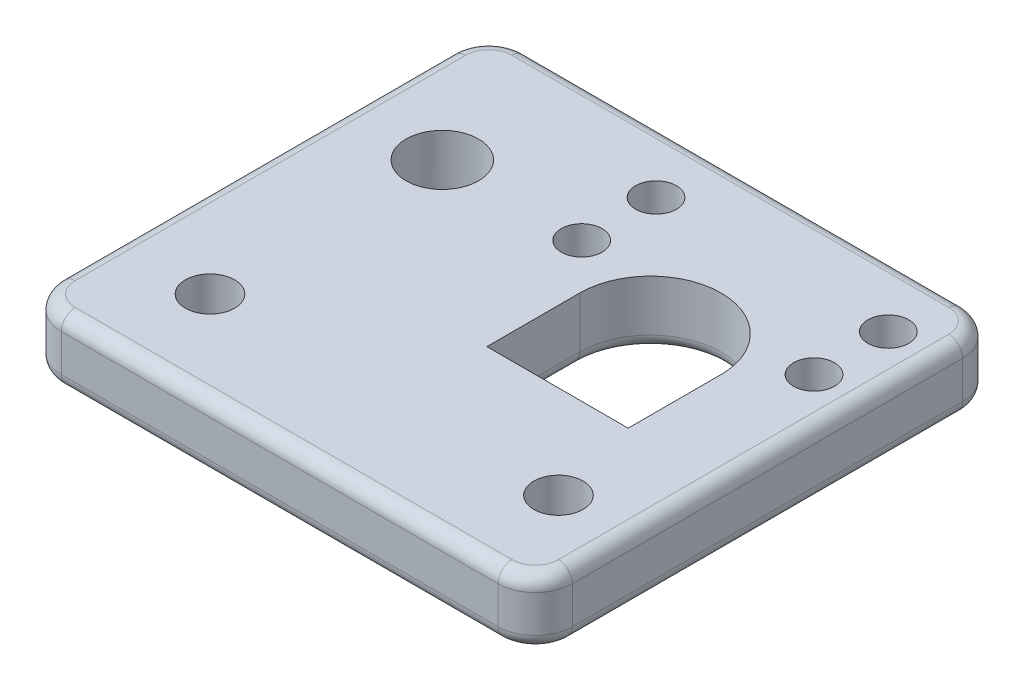
from build123d import *

# Parameters (mm, degrees)
SKETCH1_W                    = 55
SKETCH1_H                    = 50
BOSS_EXTRUDE1_DEPTH          = 7
SKETCH6_W                    = 15.2
SKETCH6_H                    = 10
CUT_EXTRUDE1_DEPTH           = 10
M5_CLEARANCE_HOLE1_OUTLINE_R = 2.65
M5_CLEARANCE_HOLE1_DEPTH     = 7
F_4_4_4_4_DIAMETER_HOLE2_D   = 4.4
F_7_8_7_8_DIAMETER_HOLE1_D   = 7.8
FILLET1_R                    = 4
FILLET2_R                    = 1.5
CHAMFER1_SIZE                = 1


# Read off the part's stored shape, not the designer's step: M5 Clearance Hole1
with BuildPart() as part:
    # Sketch1 → Boss-Extrude1 (new body)
    with BuildSketch(Plane(origin=(0, 0, 0), x_dir=(1, 0, 0), z_dir=(0, 1, 0))):
        with Locations((7.5, 25)):
            Rectangle(SKETCH1_W, SKETCH1_H)
    extrude(amount=BOSS_EXTRUDE1_DEPTH)

    # Sketch6 → Cut-Extrude1 (cut)
    with BuildSketch(Plane.XZ):
        with Locations((17.4, -25)):
            Rectangle(SKETCH6_W, SKETCH6_H)
        with BuildLine():
            Line((9.8, -30), (25, -30))
            ThreePointArc((25, -30), (17.4, -37.6), (9.8, -30))
        make_face()
    extrude(amount=-CUT_EXTRUDE1_DEPTH, mode=Mode.SUBTRACT)

    # M5 Clearance Hole1 outline → M5 Clearance Hole1 (cut)
    with BuildSketch(Plane(origin=(0, 0, 0), x_dir=(1, 0, 0), z_dir=(0, 1, 0))):
        with Locations((-10, 10)):
            Circle(M5_CLEARANCE_HOLE1_OUTLINE_R)
        with Locations((27.5, 10)):
            Circle(M5_CLEARANCE_HOLE1_OUTLINE_R)
    extrude(amount=M5_CLEARANCE_HOLE1_DEPTH, mode=Mode.SUBTRACT)

    # Ø4.4 (4.4) Diameter Hole2 (through all)
    with Locations(Plane.XZ):
        with Locations((30, -43), (5, -35), (30, -35), (5, -43)):
            Hole(F_4_4_4_4_DIAMETER_HOLE2_D / 2)

    # Ø7.8 (7.8) Diameter Hole1 (through all)
    with Locations(Plane.XZ):
        with Locations((-10, -35)):
            Hole(F_7_8_7_8_DIAMETER_HOLE1_D / 2)

    # Fillet1
    fillet1_edges = [part.edges().sort_by_distance(p)[0] for p in [
        (35, 3.5, -50),
        (35, 3.5, 0),
        (-20, 3.5, 0),
        (-20, 3.5, -50),
    ]]
    fillet(fillet1_edges, radius=FILLET1_R)

    # Fillet2
    fillet2_edges = [part.edges().sort_by_distance(p)[0] for p in [
        (7.5, 0, 0),
        (7.5, 7, 0),
        (-20, 0, -25),
        (7.5, 0, -50),
        (35, 0, -25),
        (33.828427125, 0, -1.171572875),
        (33.828427125, 0, -48.828427125),
        (-18.828427125, 0, -48.828427125),
        (-18.828427125, 0, -1.171572875),
        (-20, 7, -25),
        (7.5, 7, -50),
        (35, 7, -25),
        (33.828427125, 7, -1.171572875),
        (33.828427125, 7, -48.828427125),
        (-18.828427125, 7, -48.828427125),
        (-18.828427125, 7, -1.171572875),
        (25, 0, -25),
        (17.4, 0, -20),
        (9.8, 0, -25),
        (17.4, 0, -37.6),
    ]]
    fillet(fillet2_edges, radius=FILLET2_R)

    # Chamfer1
    chamfer1_edges = [part.edges().sort_by_distance(p)[0] for p in [
        (-6.1, 0, -35),
    ]]
    chamfer(chamfer1_edges, length=CHAMFER1_SIZE)


solid = part.part
